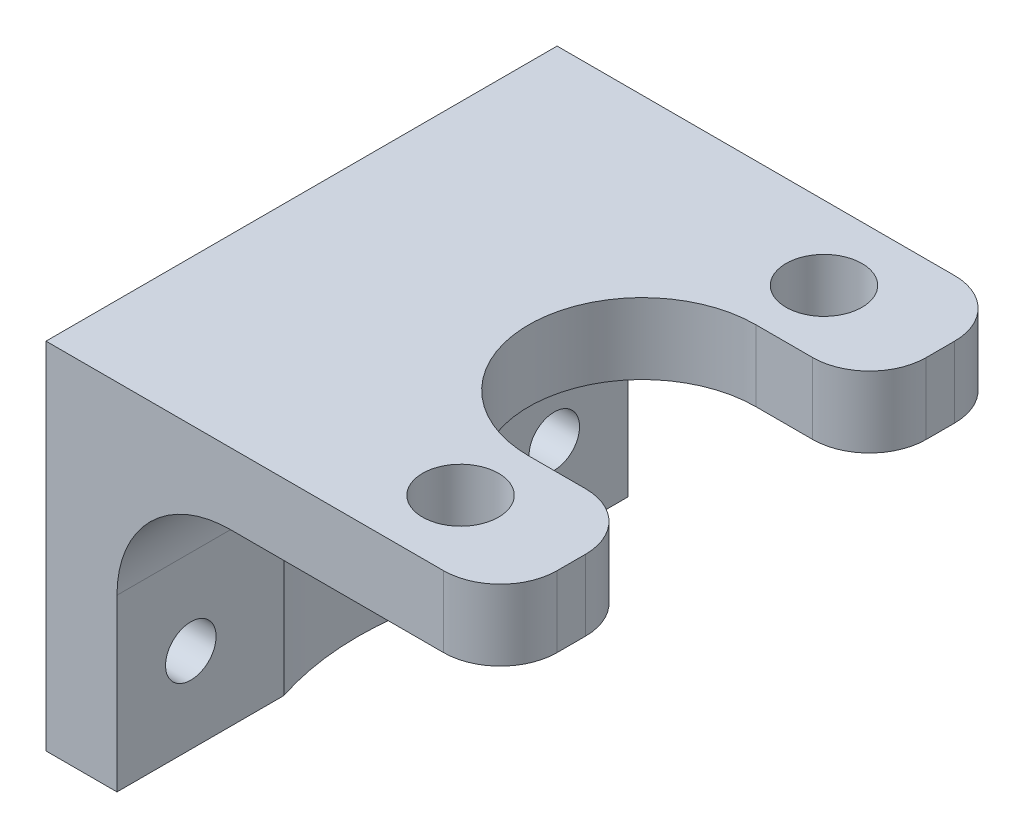
from build123d import *

# Parameters (mm, degrees)
SKETCH1_W             = 20.32
SKETCH1_H             = 22.86
BOSS_EXTRUDE1_DEPTH   = 3.175
FILLET1_R             = 2.54
FILLET2_R             = 2.54
CUT_EXTRUDE2_DEPTH    = 16.618934823
FILLET3_R             = 2.54
FILLET4_R             = 2.54
SKETCH4_W             = 3.175
SKETCH4_H             = 22.86
BOSS_EXTRUDE2_DEPTH   = 12.7
FILLET6_R             = 5.08
SKETCH5_R             = 12.7
CUT_EXTRUDE4_DEPTH    = 20.87864432
F_4_40_TAPPED_HOLE3_D = 2.2606
M3_CLEARANCE_HOLE1_D  = 3.4


with BuildPart() as part:
    # Sketch1 → Boss-Extrude1 (new body)
    with BuildSketch(Plane(origin=(0, 0, 0), x_dir=(1, 0, 0), z_dir=(0, 1, 0))):
        Rectangle(SKETCH1_W, SKETCH1_H)
    extrude(amount=BOSS_EXTRUDE1_DEPTH)

    # Fillet1
    fillet1_edges = [part.edges().sort_by_distance(p)[0] for p in [
        (10.16, 1.5875, -11.43),
    ]]
    fillet(fillet1_edges, radius=FILLET1_R)

    # Fillet2
    fillet2_edges = [part.edges().sort_by_distance(p)[0] for p in [
        (10.16, 1.5875, 11.43),
    ]]
    fillet(fillet2_edges, radius=FILLET2_R)

    # Sketch2 → Cut-Extrude2 (cut, through all)
    with BuildSketch(Plane.XZ):
        with BuildLine():
            Line((5.08, -5.08), (10.16, -5.08))
            Line((10.16, -5.08), (10.16, 5.08))
            Line((10.16, 5.08), (5.08, 5.08))
            ThreePointArc((5.08, 5.08), (0, 0), (5.08, -5.08))
        make_face()
    extrude(amount=-CUT_EXTRUDE2_DEPTH, mode=Mode.SUBTRACT)

    # Fillet3
    fillet3_edges = [part.edges().sort_by_distance(p)[0] for p in [
        (10.16, 1.5875, 5.08),
    ]]
    fillet(fillet3_edges, radius=FILLET3_R)

    # Fillet4
    fillet4_edges = [part.edges().sort_by_distance(p)[0] for p in [
        (10.16, 1.5875, -5.08),
    ]]
    fillet(fillet4_edges, radius=FILLET4_R)

    # Sketch4 → Boss-Extrude2 (add)
    with BuildSketch(Plane.XZ):
        with Locations((-8.5725, 0)):
            Rectangle(SKETCH4_W, SKETCH4_H)
    extrude(amount=BOSS_EXTRUDE2_DEPTH)

    # Fillet6
    fillet6_edges = [part.edges().sort_by_distance(p)[0] for p in [
        (-6.985, 0, 0),
    ]]
    fillet(fillet6_edges, radius=FILLET6_R)

    # Sketch5 → Cut-Extrude4 (cut, through all)
    with BuildSketch(Plane.XZ):
        with Locations((5.08, 0)):
            Circle(SKETCH5_R)
    extrude(amount=CUT_EXTRUDE4_DEPTH, mode=Mode.SUBTRACT)

    # #4-40 Tapped Hole3 (through all)
    with Locations(Plane(origin=(-6.985, 0, 0), x_dir=(0, 0, -1), z_dir=(1, 0, 0))):
        with Locations((-8.128, -8.89), (8.128, -8.89)):
            Hole(F_4_40_TAPPED_HOLE3_D / 2)

    # M3 Clearance Hole1 (through all)
    with Locations(Plane(origin=(0, 0, 0), x_dir=(-1, 0, 0), z_dir=(0, -1, 0))):
        with Locations((-5.08, -8.128), (-5.08, 8.128)):
            Hole(M3_CLEARANCE_HOLE1_D / 2)


solid = part.part
